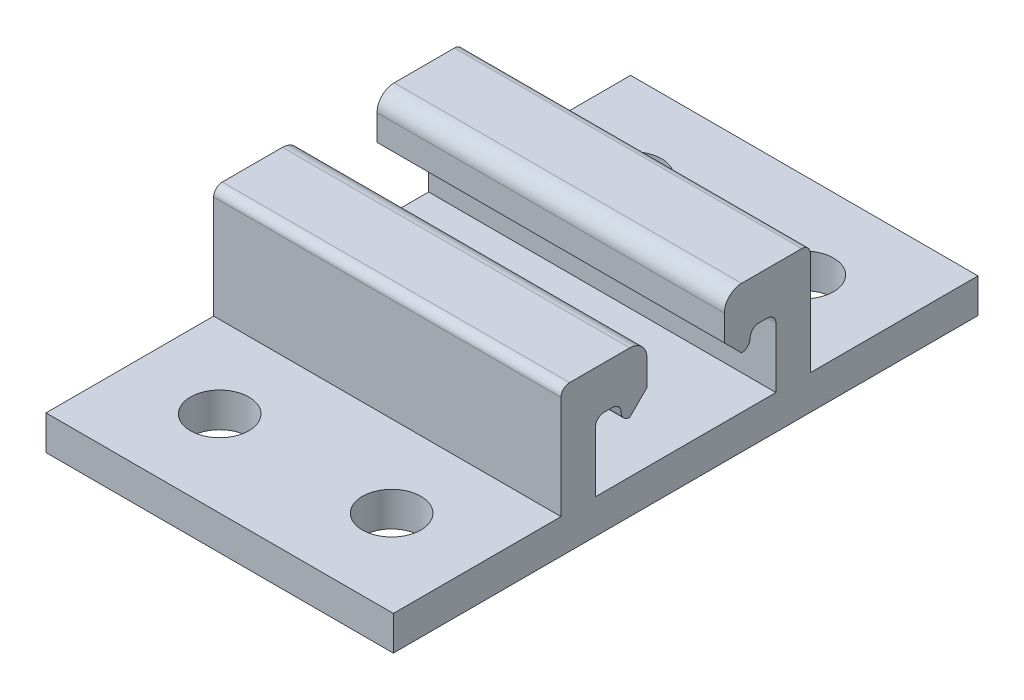
from build123d import *

# Parameters (mm, degrees)
SCHIZZO1_W                   = 20.2
SCHIZZO1_H                   = 34
ESTRUSIONE_ESTRUSIONE1_DEPTH = 2
ESTRUSIONE_ESTRUSIONE2_DEPTH = 20.2
SMUSSO1_SIZE                 = 1
RACCORDO2_R                  = 0.5
RACCORDO3_R                  = 1
FORO_PER_VITE_M3_1_D         = 3.4
SMUSSO1_OF_SPECCHIA2_SIZE    = 1
RACCORDO2_OF_SPECCHIA2_R     = 0.5
RACCORDO3_OF_SPECCHIA2_R     = 1


with BuildPart() as part:
    # Schizzo1 → Estrusione-Estrusione1 (new body)
    with BuildSketch(Plane(origin=(0, 0, 0), x_dir=(1, 0, 0), z_dir=(0, 1, 0))):
        Rectangle(SCHIZZO1_W, SCHIZZO1_H)
    extrude(amount=ESTRUSIONE_ESTRUSIONE1_DEPTH)

    # Schizzo3 → Estrusione-Estrusione2 (add)
    with BuildSketch(Plane(origin=(10.1, 0, 0), x_dir=(0, 0, -1), z_dir=(1, 0, 0))):
        Polygon((-7.25, 2), (-5.25, 2), (-5.25, 6), (-3.75, 6), (-3.75, 5), (-2.25, 5), (-2.25, 8.5), (-7.25, 8.5), align=None)
    estrusione_estrusione2 = extrude(amount=-ESTRUSIONE_ESTRUSIONE2_DEPTH)

    # Smusso1
    smusso1_edges = [part.edges().sort_by_distance(p)[0] for p in [
        (0, 5, 2.25),
    ]]
    chamfer(smusso1_edges, length=SMUSSO1_SIZE)

    # Raccordo2
    raccordo2_edges = [part.edges().sort_by_distance(p)[0] for p in [
        (0, 6, 5.25),
        (0, 6, 3.75),
    ]]
    fillet(raccordo2_edges, radius=RACCORDO2_R)
    raccordo2_2_edges = [part.edges().sort_by_distance(p)[0] for p in [
        (0, 8.5, 7.25),
        (0, 5, 3.75),
    ]]
    fillet(raccordo2_2_edges, radius=RACCORDO2_R - 0.0001)  # a hair under: the kernel refuses the full size

    # Raccordo3
    raccordo3_edges = [part.edges().sort_by_distance(p)[0] for p in [
        (0, 8.5, 2.25),
    ]]
    fillet(raccordo3_edges, radius=RACCORDO3_R)

    # Foro per Vite M3-1 (through all)
    with Locations(Plane(origin=(0, 2, 0), x_dir=(1, 0, 0), z_dir=(0, 1, 0))):
        with Locations((-5, -12), (5, -12)):
            foro_per_vite_m3_1 = Hole(FORO_PER_VITE_M3_1_D / 2)

    # Specchia2: Estrusione-Estrusione2, Foro per Vite M3-1 across plane
    add(estrusione_estrusione2.mirror(Plane.XY))
    add(foro_per_vite_m3_1.mirror(Plane.XY), mode=Mode.SUBTRACT)

    # Smusso1 of Specchia2
    smusso1_of_specchia2_edges = [part.edges().sort_by_distance(p)[0] for p in [
        (0, 5, -2.25),
    ]]
    chamfer(smusso1_of_specchia2_edges, length=SMUSSO1_OF_SPECCHIA2_SIZE)

    # Raccordo2 of Specchia2
    raccordo2_of_specchia2_edges = [part.edges().sort_by_distance(p)[0] for p in [
        (0, 6, -5.25),
        (0, 6, -3.75),
    ]]
    fillet(raccordo2_of_specchia2_edges, radius=RACCORDO2_OF_SPECCHIA2_R)
    raccordo2_of_specchia2_2_edges = [part.edges().sort_by_distance(p)[0] for p in [
        (0, 8.5, -7.25),
        (0, 5, -3.75),
    ]]
    fillet(raccordo2_of_specchia2_2_edges, radius=RACCORDO2_OF_SPECCHIA2_R - 0.0001)  # a hair under: the kernel refuses the full size

    # Raccordo3 of Specchia2
    raccordo3_of_specchia2_edges = [part.edges().sort_by_distance(p)[0] for p in [
        (0, 8.5, -2.25),
    ]]
    fillet(raccordo3_of_specchia2_edges, radius=RACCORDO3_OF_SPECCHIA2_R)


solid = part.part
